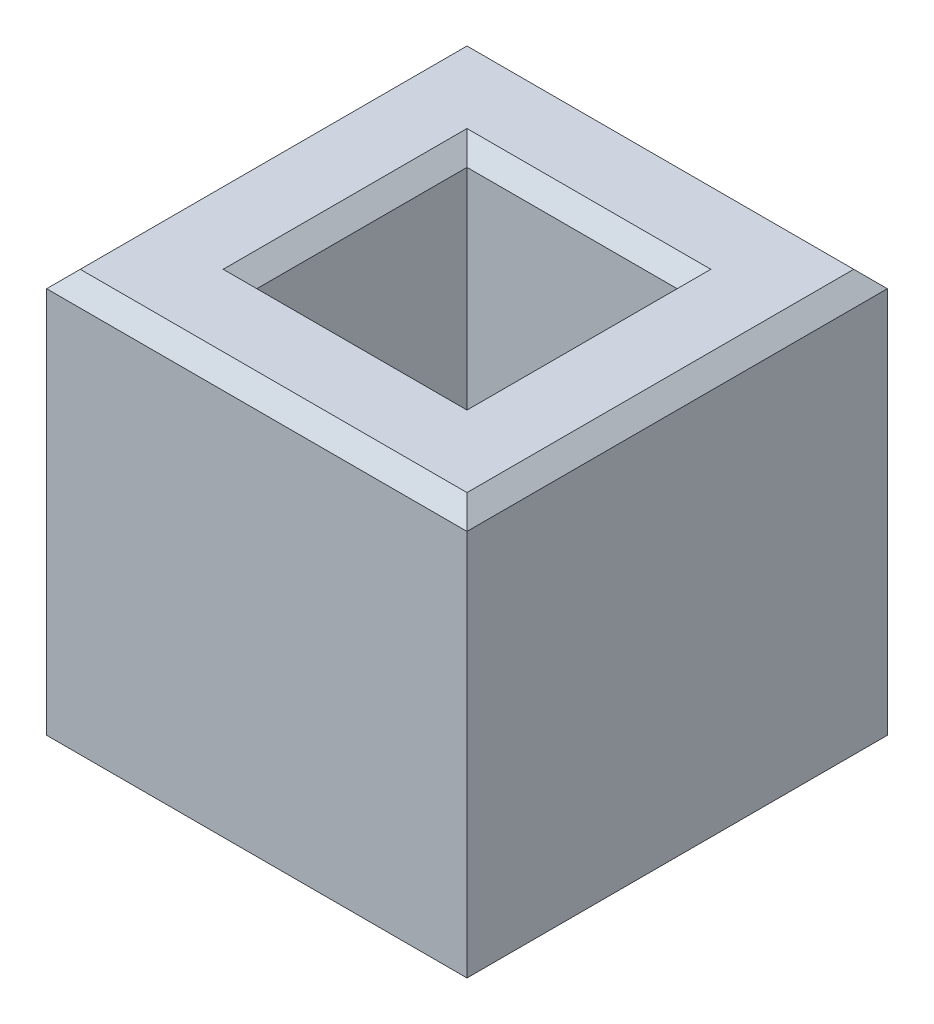
from build123d import *

# Parameters (mm, degrees)
SKETCH1_W           = 127
SKETCH1_H           = 127
BOSS_EXTRUDE1_DEPTH = 127
SKETCH2_W           = 63.5
SKETCH2_H           = 63.5
CUT_EXTRUDE1_DEPTH  = 156.542598667
CHAMFER1_SIZE       = 5.08


with BuildPart() as part:
    # Sketch1 → Boss-Extrude1 (new body)
    with BuildSketch(Plane(origin=(0, 0, 0), x_dir=(1, 0, 0), z_dir=(0, 1, 0))):
        Rectangle(SKETCH1_W, SKETCH1_H)
    extrude(amount=BOSS_EXTRUDE1_DEPTH)

    # Sketch2 → Cut-Extrude1 (cut, through all)
    with BuildSketch(Plane(origin=(0, 127, 0), x_dir=(1, 0, 0), z_dir=(0, 1, 0))):
        Rectangle(SKETCH2_W, SKETCH2_H)
    extrude(amount=-CUT_EXTRUDE1_DEPTH, mode=Mode.SUBTRACT)

    # Chamfer1
    chamfer1_edges = [part.edges().sort_by_distance(p)[0] for p in [
        (0, 0, -63.5),
        (-63.5, 0, 0),
        (0, 0, 63.5),
        (63.5, 0, 0),
        (0, 0, 31.75),
        (-31.75, 0, 0),
        (0, 0, -31.75),
        (31.75, 0, 0),
        (0, 127, 63.5),
        (-63.5, 127, 0),
        (0, 127, -63.5),
        (63.5, 127, 0),
        (-31.75, 127, 0),
        (0, 127, 31.75),
        (31.75, 127, 0),
        (0, 127, -31.75),
    ]]
    chamfer(chamfer1_edges, length=CHAMFER1_SIZE)


solid = part.part
